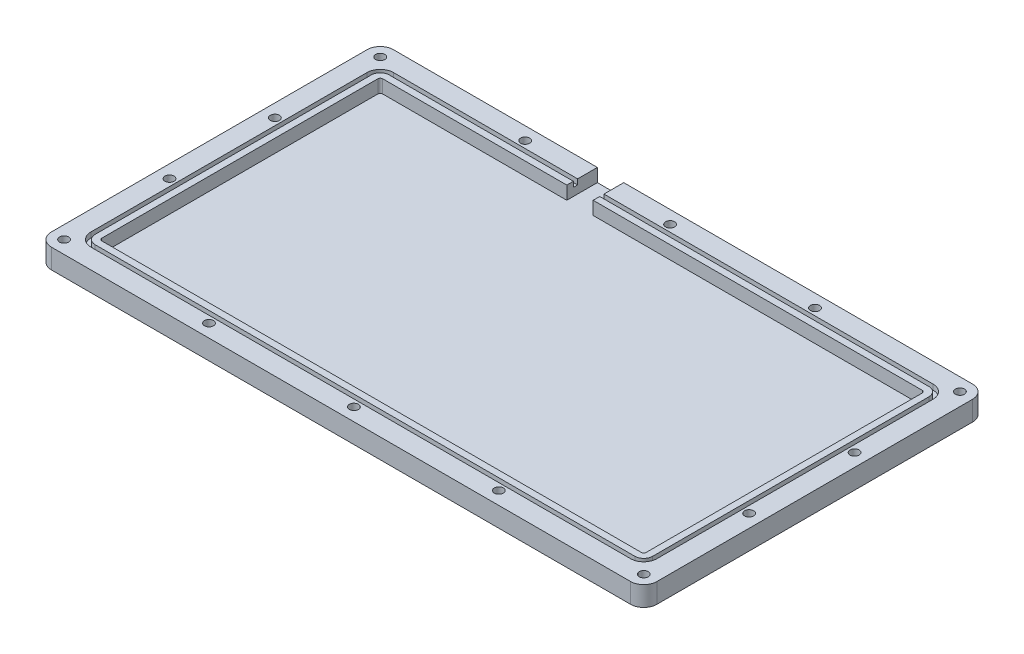
from build123d import *

# Parameters (mm, degrees)
SKETCH1_W           = 291.846
SKETCH1_H           = 164.846
BOSS_EXTRUDE1_DEPTH = 9.525
FILLET1_R           = 6.35
SKETCH2_R           = 2.1844
CUT_EXTRUDE1_DEPTH  = 336.319276298
CHAMFER1_SIZE       = 2.54
CHAMFER1_SIZE2      = 2.207988314
CUT_EXTRUDE3_DEPTH  = 2.54
CUT_EXTRUDE4_DEPTH  = 6.35
CUT_EXTRUDE5_REACH  = 337.319
SKETCH5_W           = 12.7
SKETCH5_H           = 6.35


# Read off the part's stored shape, not the designer's step: LPattern1, LPattern2
with BuildPart() as part:
    # Sketch1 → Boss-Extrude1 (new body)
    with BuildSketch(Plane(origin=(0, 0, 0), x_dir=(1, 0, 0), z_dir=(0, 1, 0))):
        with Locations((145.923, 82.423)):
            Rectangle(SKETCH1_W, SKETCH1_H)
    extrude(amount=BOSS_EXTRUDE1_DEPTH)

    # Fillet1
    fillet1_edges = [part.edges().sort_by_distance(p)[0] for p in [
        (0, 4.7625, -164.846),
        (291.846, 4.7625, -164.846),
        (291.846, 4.7625, 0),
        (0, 4.7625, 0),
    ]]
    fillet(fillet1_edges, radius=FILLET1_R)

    # Sketch2 → Cut-Extrude1 (cut, through all)
    with BuildSketch(Plane.XZ):
        with Locations(Location((6.223, -6.223, 0), (0, 0, 270))):
            Circle(SKETCH2_R)
        with Locations(Location((285.623, -6.223, 0), (0, 0, 270))):
            Circle(SKETCH2_R)
        with Locations(Location((6.223, -158.623, 0), (0, 0, 270))):
            Circle(SKETCH2_R)
        with Locations(Location((285.623, -158.623, 0), (0, 0, 270))):
            Circle(SKETCH2_R)
    extrude(amount=-CUT_EXTRUDE1_DEPTH, mode=Mode.SUBTRACT)

    # Chamfer1
    chamfer1_edges = [part.edges().sort_by_distance(p)[0] for p in [
        (6.223, 0, -4.0386),
        (285.623, 0, -4.0386),
        (6.223, 0, -156.4386),
        (285.623, 0, -156.4386),
    ]]
    chamfer1_side = [part.faces().sort_by_distance(p)[0] for p in [
        (145.923, 0, -82.423),
    ]]
    chamfer(chamfer1_edges, length=CHAMFER1_SIZE, length2=CHAMFER1_SIZE2, reference=chamfer1_side[0])

    # LPattern1 outline → LPattern1 (revolve, cut)
    with BuildSketch(Plane(origin=(285.623, 0, -107.823), x_dir=(1, 0, 0), z_dir=(0, 0, 1))):
        Polygon((0, 0), (4.7244, 0), (2.1844, 2.207988314), (2.1844, 9.525), (0, 9.525), align=None)
    revolve(axis=Axis((285.623, 0, -107.823), (0, 1, 0)), mode=Mode.SUBTRACT)

    # LPattern1 2 outline → LPattern1 2 (revolve, cut)
    with BuildSketch(Plane(origin=(6.223, 0, -107.823), x_dir=(1, 0, 0), z_dir=(0, 0, 1))):
        Polygon((0, 0), (4.7244, 0), (2.1844, 2.207988314), (2.1844, 9.525), (0, 9.525), align=None)
    revolve(axis=Axis((6.223, 0, -107.823), (0, 1, 0)), mode=Mode.SUBTRACT)

    # LPattern1 3 outline → LPattern1 3 (revolve, cut)
    with BuildSketch(Plane(origin=(285.623, 0, -57.023), x_dir=(1, 0, 0), z_dir=(0, 0, 1))):
        Polygon((0, 0), (4.7244, 0), (2.1844, 2.207988314), (2.1844, 9.525), (0, 9.525), align=None)
    revolve(axis=Axis((285.623, 0, -57.023), (0, 1, 0)), mode=Mode.SUBTRACT)

    # LPattern1 4 outline → LPattern1 4 (revolve, cut)
    with BuildSketch(Plane(origin=(6.223, 0, -57.023), x_dir=(1, 0, 0), z_dir=(0, 0, 1))):
        Polygon((0, 0), (4.7244, 0), (2.1844, 2.207988314), (2.1844, 9.525), (0, 9.525), align=None)
    revolve(axis=Axis((6.223, 0, -57.023), (0, 1, 0)), mode=Mode.SUBTRACT)

    # LPattern2 outline → LPattern2 (revolve, cut)
    with BuildSketch(Plane(origin=(215.773, 0, -158.623), x_dir=(1, 0, 0), z_dir=(0, 0, 1))):
        Polygon((0, 0), (4.7244, 0), (2.1844, 2.207988314), (2.1844, 9.525), (0, 9.525), align=None)
    revolve(axis=Axis((215.773, 0, -158.623), (0, 1, 0)), mode=Mode.SUBTRACT)

    # LPattern2 2 outline → LPattern2 2 (revolve, cut)
    with BuildSketch(Plane(origin=(215.773, 0, -6.223), x_dir=(1, 0, 0), z_dir=(0, 0, 1))):
        Polygon((0, 0), (4.7244, 0), (2.1844, 2.207988314), (2.1844, 9.525), (0, 9.525), align=None)
    revolve(axis=Axis((215.773, 0, -6.223), (0, 1, 0)), mode=Mode.SUBTRACT)

    # LPattern2 3 outline → LPattern2 3 (revolve, cut)
    with BuildSketch(Plane(origin=(145.923, 0, -158.623), x_dir=(1, 0, 0), z_dir=(0, 0, 1))):
        Polygon((0, 0), (4.7244, 0), (2.1844, 2.207988314), (2.1844, 9.525), (0, 9.525), align=None)
    revolve(axis=Axis((145.923, 0, -158.623), (0, 1, 0)), mode=Mode.SUBTRACT)

    # LPattern2 4 outline → LPattern2 4 (revolve, cut)
    with BuildSketch(Plane(origin=(145.923, 0, -6.223), x_dir=(1, 0, 0), z_dir=(0, 0, 1))):
        Polygon((0, 0), (4.7244, 0), (2.1844, 2.207988314), (2.1844, 9.525), (0, 9.525), align=None)
    revolve(axis=Axis((145.923, 0, -6.223), (0, 1, 0)), mode=Mode.SUBTRACT)

    # LPattern2 5 outline → LPattern2 5 (revolve, cut)
    with BuildSketch(Plane(origin=(76.073, 0, -158.623), x_dir=(1, 0, 0), z_dir=(0, 0, 1))):
        Polygon((0, 0), (4.7244, 0), (2.1844, 2.207988314), (2.1844, 9.525), (0, 9.525), align=None)
    revolve(axis=Axis((76.073, 0, -158.623), (0, 1, 0)), mode=Mode.SUBTRACT)

    # LPattern2 6 outline → LPattern2 6 (revolve, cut)
    with BuildSketch(Plane(origin=(76.073, 0, -6.223), x_dir=(1, 0, 0), z_dir=(0, 0, 1))):
        Polygon((0, 0), (4.7244, 0), (2.1844, 2.207988314), (2.1844, 9.525), (0, 9.525), align=None)
    revolve(axis=Axis((76.073, 0, -6.223), (0, 1, 0)), mode=Mode.SUBTRACT)

    # Sketch3 → Cut-Extrude3 (cut)
    with BuildSketch(Plane(origin=(0, 9.525, 0), x_dir=(1, 0, 0), z_dir=(0, 1, 0))):
        with BuildLine():
            Line((275.971, 9.525), (15.875, 9.525))
            ThreePointArc((15.875, 9.525), (11.384871939, 11.384871939), (9.525, 15.875))
            Line((9.525, 15.875), (9.525, 148.971))
            ThreePointArc((9.525, 148.971), (11.384871939, 153.461128061), (15.875, 155.321))
            Line((15.875, 155.321), (275.971, 155.321))
            ThreePointArc((275.971, 155.321), (280.461128061, 153.461128061), (282.321, 148.971))
            Line((282.321, 148.971), (282.321, 15.875))
            ThreePointArc((282.321, 15.875), (280.461128061, 11.384871939), (275.971, 9.525))
        make_face()
        with BuildLine():
            ThreePointArc((275.971, 11.557), (279.024287081, 12.821712919), (280.289, 15.875))
            Line((280.289, 15.875), (280.289, 148.971))
            ThreePointArc((280.289, 148.971), (279.024287081, 152.024287081), (275.971, 153.289))
            Line((275.971, 153.289), (15.875, 153.289))
            ThreePointArc((15.875, 153.289), (12.821712919, 152.024287081), (11.557, 148.971))
            Line((11.557, 148.971), (11.557, 15.875))
            ThreePointArc((11.557, 15.875), (12.821712919, 12.821712919), (15.875, 11.557))
            Line((15.875, 11.557), (275.971, 11.557))
        make_face(mode=Mode.SUBTRACT)
    extrude(amount=-CUT_EXTRUDE3_DEPTH, mode=Mode.SUBTRACT)

    # Sketch4 → Cut-Extrude4 (cut)
    with BuildSketch(Plane(origin=(0, 9.525, 0), x_dir=(1, 0, 0), z_dir=(0, 1, 0))):
        with BuildLine():
            Line((14.732, 148.971), (14.732, 15.875))
            ThreePointArc((14.732, 15.875), (15.066776949, 15.066776949), (15.875, 14.732))
            Line((15.875, 14.732), (275.971, 14.732))
            ThreePointArc((275.971, 14.732), (276.779223051, 15.066776949), (277.114, 15.875))
            Line((277.114, 15.875), (277.114, 148.971))
            ThreePointArc((277.114, 148.971), (276.779223051, 149.779223051), (275.971, 150.114))
            Line((275.971, 150.114), (15.875, 150.114))
            ThreePointArc((15.875, 150.114), (15.066776949, 149.779223051), (14.732, 148.971))
        make_face()
    extrude(amount=-CUT_EXTRUDE4_DEPTH, mode=Mode.SUBTRACT)

    # Cut-Extrude5: up to this face of the body (flat: up to its plane)
    cut_extrude5_end = Plane(part.part.faces().sort_by_distance((145.923, 6.35, -150.114))[0])
    # Sketch5 → Cut-Extrude5 (cut, up to the picked face)
    with BuildSketch(Plane(origin=(0, 0, -164.846), x_dir=(-1, 0, 0), z_dir=(0, 0, -1)), mode=Mode.PRIVATE) as cut_extrude5_sk1:
        with Locations((-110.998, 6.35)):
            Rectangle(SKETCH5_W, SKETCH5_H)
    cut_extrude5_tool1 = split(extrude(cut_extrude5_sk1.sketch, amount=-CUT_EXTRUDE5_REACH, mode=Mode.PRIVATE), bisect_by=cut_extrude5_end, keep=Keep.BOTH, mode=Mode.PRIVATE)
    add(cut_extrude5_tool1.solids().sort_by(Axis((110.998, 6.35, -164.846), (0, 0, 1)))[0], mode=Mode.SUBTRACT)


solid = part.part
